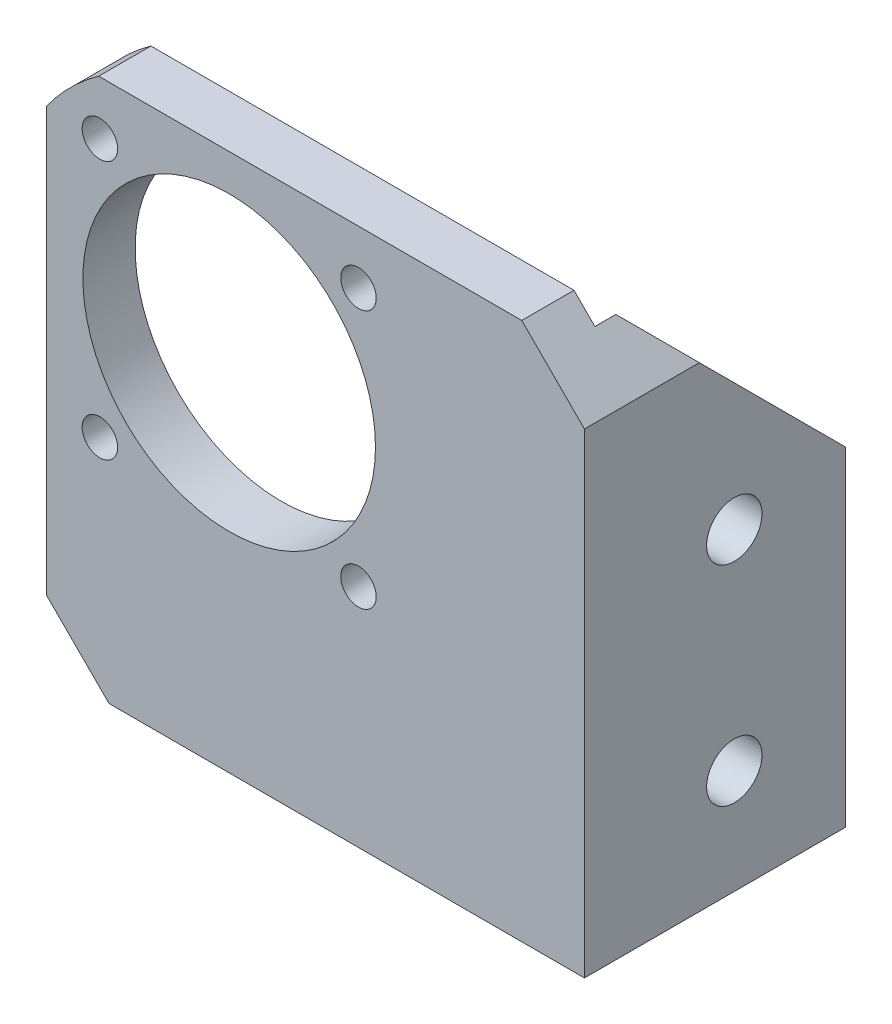
from build123d import *

# Parameters (mm, degrees)
ESQUISSE2_R             = 14
ESQUISSE2_R_2           = 1.7
BOSS_EXTRU_1_DEPTH      = 5
BOSS_EXTRU_2_DEPTH      = 5
BOSS_EXTRU_3_DEPTH      = 20
CHANFREIN1_SIZE         = 20
ENL_V_MAT_EXTRU_1_DEPTH = 25
CHANFREIN2_SIZE         = 6
ESQUISSE6_R             = 2.65
ENL_V_MAT_EXTRU_2_DEPTH = 25
ESQUISSE7_R             = 2.65
ENL_V_MAT_EXTRU_3_DEPTH = 25


# Some blends are built 0.0001 mm under size
with BuildPart() as part:
    # Esquisse2 → Boss.-Extru.1 (new body)
    with BuildSketch(Plane.XY):
        with BuildLine():
            Line((12.489995997, 17.5), (-12.489995997, 17.5))
            ThreePointArc((-12.489995997, 17.5), (-15.202795796, 15.202795796), (-17.5, 12.489995997))
            Line((-17.5, 12.489995997), (-17.5, -12.489995997))
            ThreePointArc((-17.5, -12.489995997), (-15.202795796, -15.202795796), (-12.489995997, -17.5))
            Line((-12.489995997, -17.5), (12.489995997, -17.5))
            ThreePointArc((12.489995997, -17.5), (15.202795796, -15.202795796), (17.5, -12.489995997))
            Line((17.5, -12.489995997), (17.5, 12.489995997))
            ThreePointArc((17.5, 12.489995997), (15.202795796, 15.202795796), (12.489995997, 17.5))
        make_face()
        Circle(ESQUISSE2_R, mode=Mode.SUBTRACT)
        with Locations((-12.374368671, -12.374368671)):
            Circle(ESQUISSE2_R_2, mode=Mode.SUBTRACT)
        with Locations((12.374368671, -12.374368671)):
            Circle(ESQUISSE2_R_2, mode=Mode.SUBTRACT)
        with Locations((12.374368671, 12.374368671)):
            Circle(ESQUISSE2_R_2, mode=Mode.SUBTRACT)
        with Locations((-12.374368671, 12.374368671)):
            Circle(ESQUISSE2_R_2, mode=Mode.SUBTRACT)
    extrude(amount=BOSS_EXTRU_1_DEPTH)



with BuildPart() as body_2:
    # Esquisse3 → Boss.-Extru.2 (new body)
    with BuildSketch(Plane.XY.offset(5)):
        with BuildLine():
            Line((-17.5, -12.489995997), (-17.5, -34))
            Line((-17.5, -34), (34, -34))
            Line((34, -34), (34, 17.5))
            Line((34, 17.5), (12.489995997, 17.5))
            ThreePointArc((12.489995997, 17.5), (15.202795796, 15.202795796), (17.5, 12.489995997))
            Line((17.5, 12.489995997), (17.5, -12.489995997))
            ThreePointArc((17.5, -12.489995997), (15.202795796, -15.202795796), (12.489995997, -17.5))
            Line((12.489995997, -17.5), (-12.489995997, -17.5))
            ThreePointArc((-12.489995997, -17.5), (-15.202795796, -15.202795796), (-17.5, -12.489995997))
        make_face()
    extrude(amount=-BOSS_EXTRU_2_DEPTH)


with BuildPart() as part_1:
    add(part.part)

    add(body_2.part)  # Boss.-Extru.3 merges body 2
    # Esquisse4 → Boss.-Extru.3 (add)
    with BuildSketch(Plane(origin=(0, 0, 0), x_dir=(-1, 0, 0), z_dir=(0, 0, -1))):
        Polygon((-34, 17.5), (-34, -34), (17.65, -34), (17.5, -30), (-30, -30), (-30, 17.5), align=None)
    extrude(amount=BOSS_EXTRU_3_DEPTH)

    # Chanfrein1
    chanfrein1_edges = [part_1.edges().sort_by_distance(p)[0] for p in [
        (32, 17.5, -20),
        (-17.575, -32, -20),
    ]]
    chamfer(chanfrein1_edges, length=CHANFREIN1_SIZE - 0.0001)  # a hair under: the kernel refuses the full size

    # Esquisse5 → Enlèv. mat.-Extru.1 (cut)
    with BuildSketch(Plane.XY):
        Polygon((-17.5, -34), (-17.5, -30), (-17.65, -34), align=None)
    extrude(amount=-ENL_V_MAT_EXTRU_1_DEPTH, mode=Mode.SUBTRACT)

    # Chanfrein2
    # the kernel refuses this chamfer: 6 mm, written as the material it takes off along each edge
    with BuildSketch(Plane(origin=(-17.5, -34, 20.430097928), x_dir=(0.9996219169112969, -0.027495876610582164, 0), z_dir=(0, 0, -1))) as chanfrein2_piece_1:
        Polygon((CHANFREIN2_SIZE * 0.999621916911, -CHANFREIN2_SIZE * 0.0274958766106), (-CHANFREIN2_SIZE * 0.0274958766106, -CHANFREIN2_SIZE * 0.999621916911), (0, 0), align=None)
    extrude(amount=36.010190498, mode=Mode.SUBTRACT)
    with BuildSketch(Plane(origin=(34, 17.5, -15.430197928), x_dir=(-0.9996219169112969, 0.027495876610585633, 0), z_dir=(0, 0, 1))) as chanfrein2_piece_2:
        Polygon((CHANFREIN2_SIZE * 0.999621916911, CHANFREIN2_SIZE * 0.0274958766106), (-CHANFREIN2_SIZE * 0.0274958766106, CHANFREIN2_SIZE * 0.999621916911), (0, 0), align=None)
    extrude(amount=35.860295856, mode=Mode.SUBTRACT)

    # Esquisse6 → Enlèv. mat.-Extru.2 (cut)
    with BuildSketch(Plane.ZY.offset(-30)):
        with Locations((-9.34, -4)):
            Circle(ESQUISSE6_R)
        with Locations((-9.34, -24)):
            Circle(ESQUISSE6_R)
    extrude(amount=-ENL_V_MAT_EXTRU_2_DEPTH, mode=Mode.SUBTRACT)

    # Esquisse7 → Enlèv. mat.-Extru.3 (cut)
    with BuildSketch(Plane(origin=(0, -30, 0), x_dir=(1, 0, 0), z_dir=(0, 1, 0))):
        with Locations(Location((1, 9.34, 0), (0, 0, 180))):
            Circle(ESQUISSE7_R)
        with Locations(Location((21, 9.34, 0), (0, 0, 180))):
            Circle(ESQUISSE7_R)
    extrude(amount=-ENL_V_MAT_EXTRU_3_DEPTH, mode=Mode.SUBTRACT)


solid = part_1.part
